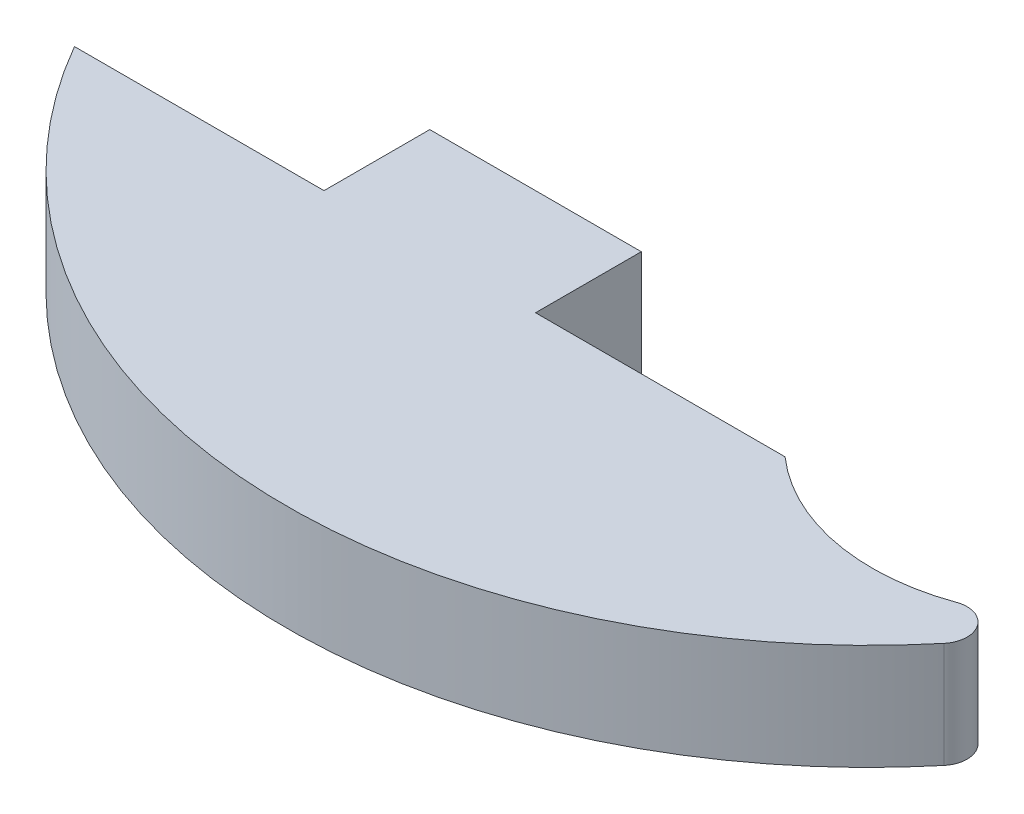
from build123d import *

# Parameters (mm, degrees)
BOSS_EXTRUDE1_DEPTH = 3.175
FILLET1_START       = -4
FILLET1_DEPTH       = 8
SKETCH2_W           = 12.7
SKETCH2_H           = 6.35
BOSS_EXTRUDE2_DEPTH = 6.35


with BuildPart() as part:
    # Sketch1 → Boss-Extrude1 (new, symmetric)
    with BuildSketch(Plane(origin=(0, 0, 0), x_dir=(1, 0, 0), z_dir=(0, 1, 0))):
        with BuildLine():
            Line((-54.202443258, -43.180856192), (-66.902443258, -43.180856192))
            ThreePointArc((-66.902443258, -43.180856192), (-33.83954697, -60.596845897), (-3.959326756, -38.154826194))
            ThreePointArc((-3.959326756, -38.154826194), (-12.780230261, -45.982812034), (-24.23600367, -43.180856192))
            Line((-24.23600367, -43.180856192), (-41.502443258, -43.180856192))
            Line((-41.502443258, -43.180856192), (-54.202443258, -43.180856192))
        make_face()
    extrude(amount=BOSS_EXTRUDE1_DEPTH, both=True)

    # Fillet1: read off the stored shape, not the designer's step
    # Fillet1 outline → Fillet1 (cut)
    with BuildSketch(Plane(origin=(0, 0, 0), x_dir=(1, 0, 0), z_dir=(0, 1, 0)).offset(FILLET1_START)):
        with BuildLine():
            ThreePointArc((-11.522510786, -45.600981794), (-9.683883576, -46.182242141), (-9.76258933, -48.108954111))
            ThreePointArc((-9.76258933, -48.108954111), (-6.447625568, -43.372863288), (-3.959326789, -38.15482628))
            ThreePointArc((-3.959326789, -38.15482628), (-6.925777422, -42.705856679), (-11.522510786, -45.600981794))
        make_face()
    extrude(amount=FILLET1_DEPTH, mode=Mode.SUBTRACT)

    # Sketch2 → Boss-Extrude2 (add)
    with BuildSketch(Plane(origin=(0, 3.175, 0), x_dir=(1, 0, 0), z_dir=(0, 1, 0))):
        with Locations((-45.569223464, -40.005856192)):
            Rectangle(SKETCH2_W, SKETCH2_H)
    extrude(amount=-BOSS_EXTRUDE2_DEPTH)


solid = part.part
